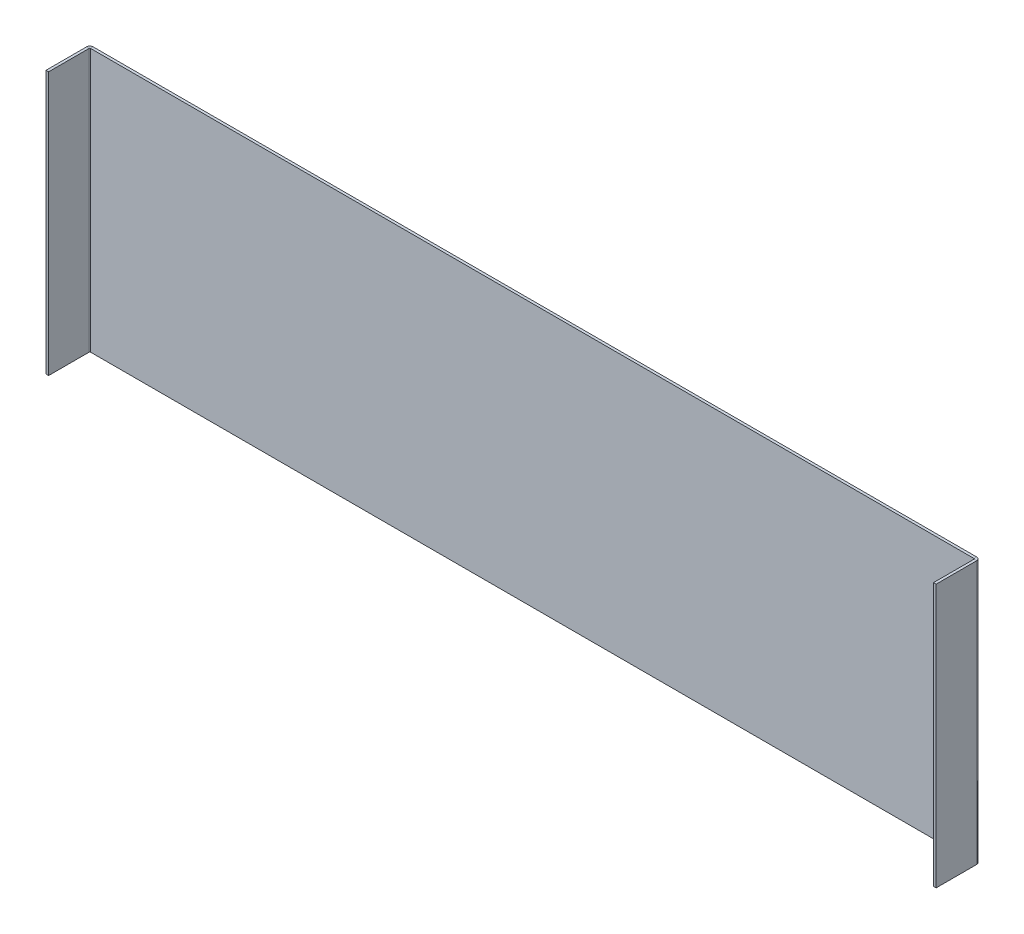
from build123d import *

# Parameters (mm, degrees)
SM_BASE_FLANGE_1_DEPTH = 150


# Sheet-metal steps are written as plain solids
with BuildPart() as part:
    # Sketch 1 → Базовая кромка1 (new, symmetric)
    with BuildSketch(Plane(origin=(0, 0, 0), x_dir=(1, 0, 0), z_dir=(0, 1, 0))):
        with BuildLine():
            Line((-507.5, -50), (-507.5, -3.75))
            ThreePointArc((-507.5, -3.75), (-506.401650429, -1.098349571), (-503.75, 0))
            Line((-503.75, 0), (503.75, 0))
            ThreePointArc((503.75, 0), (506.401650429, -1.098349571), (507.5, -3.75))
            Line((507.5, -3.75), (507.5, -50))
            Line((507.5, -50), (504.5, -50))
            Line((504.5, -50), (504.5, -3.75))
            ThreePointArc((504.5, -3.75), (504.280330086, -3.219669914), (503.75, -3))
            Line((503.75, -3), (-503.75, -3))
            ThreePointArc((-503.75, -3), (-504.280330086, -3.219669914), (-504.5, -3.75))
            Line((-504.5, -3.75), (-504.5, -50))
            Line((-504.5, -50), (-507.5, -50))
        make_face()
    extrude(amount=SM_BASE_FLANGE_1_DEPTH, both=True)


solid = part.part
